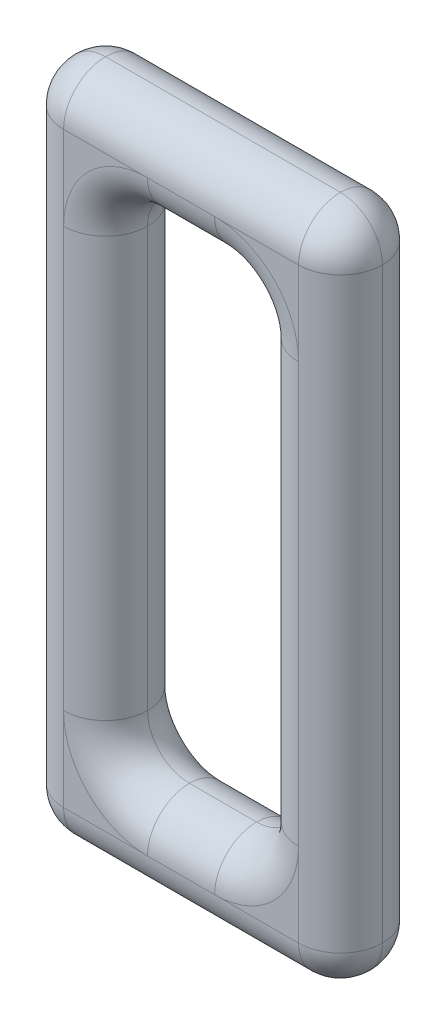
from build123d import *

# Parameters (mm, degrees)
SKETCH1_W           = 190
SKETCH1_H           = 400
SKETCH1_W_2         = 90
SKETCH1_H_2         = 300
BOSS_EXTRUDE1_DEPTH = 25
FILLET1_R           = 25


with BuildPart() as part:
    # Sketch1 → Boss-Extrude1 (new, symmetric)
    with BuildSketch(Plane.XY):
        with Locations((0, -175)):
            Rectangle(SKETCH1_W, SKETCH1_H)
        with Locations((0, -175)):
            Rectangle(SKETCH1_W_2, SKETCH1_H_2, mode=Mode.SUBTRACT)
    extrude(amount=BOSS_EXTRUDE1_DEPTH, both=True)

    # Fillet1
    fillet1_edges = [part.edges().sort_by_distance(p)[0] for p in [
        (95, -175, 25),
        (0, 25, 25),
        (-45, -175, -25),
        (-45, -25, 0),
        (0, -325, -25),
        (-45, -325, 0),
        (45, -175, -25),
        (45, -325, 0),
        (0, -25, -25),
        (45, -25, 0),
        (-45, -175, 25),
        (0, -325, 25),
        (45, -175, 25),
        (0, -25, 25),
        (-95, -175, 25),
        (0, 25, -25),
        (95, -175, -25),
        (0, -375, -25),
        (-95, -175, -25),
        (0, -375, 25),
        (-95, 25, 0),
        (95, 25, 0),
        (95, -375, 0),
        (-95, -375, 0),
    ]]
    fillet(fillet1_edges, radius=FILLET1_R - 0.0001)  # a hair under: the kernel refuses the full size


solid = part.part
